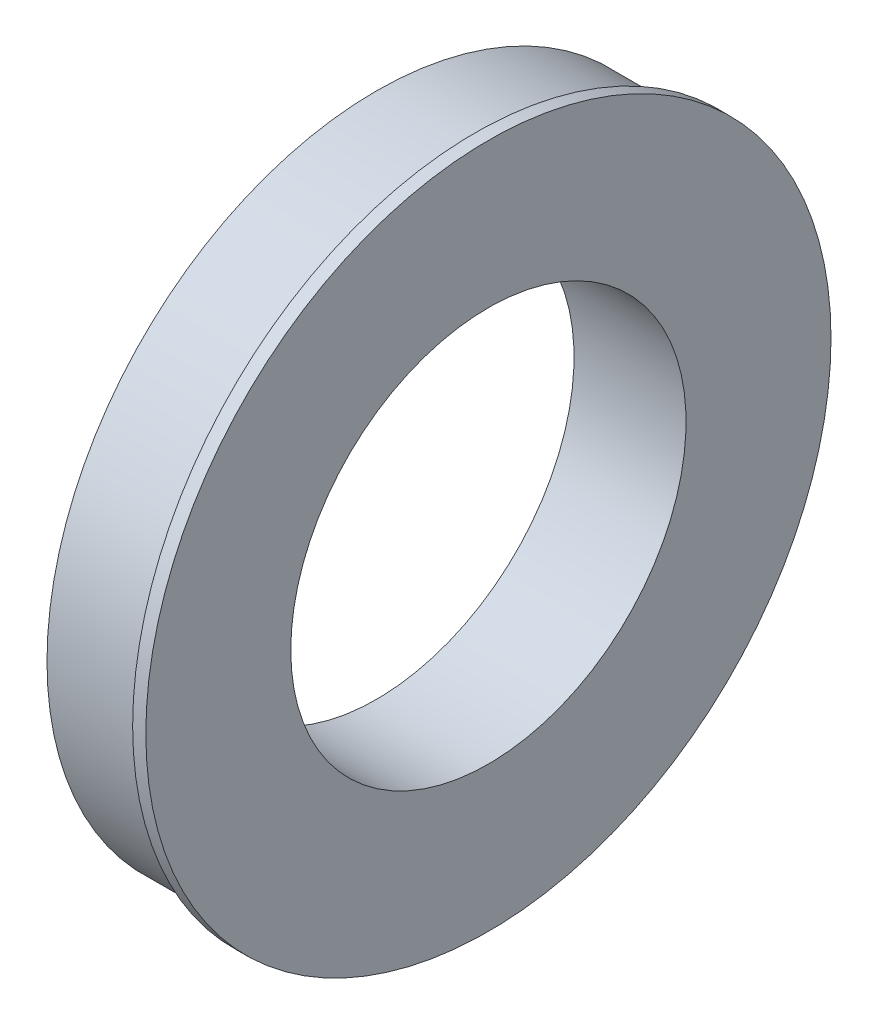
from build123d import *

# Parameters (mm, degrees)
SKETCH1_R           = 63.5
SKETCH1_R_2         = 38.1
BOSS_EXTRUDE1_DEPTH = 19.05
SKETCH2_R           = 66.04
SKETCH2_R_2         = 38.1
BOSS_EXTRUDE2_DEPTH = 2.54
SCALE1_SCALE        = 0.111317254


with BuildPart() as part:
    # Sketch1 → Boss-Extrude1 (new body)
    with BuildSketch(Plane(origin=(0, 0, 0), x_dir=(0, 0, -1), z_dir=(1, 0, 0))):
        Circle(SKETCH1_R)
        Circle(SKETCH1_R_2, mode=Mode.SUBTRACT)
    extrude(amount=BOSS_EXTRUDE1_DEPTH)

    # Sketch2 → Boss-Extrude2 (add)
    with BuildSketch(Plane(origin=(19.05, 0, 0), x_dir=(0, 0, -1), z_dir=(1, 0, 0))):
        Circle(SKETCH2_R)
        Circle(SKETCH2_R_2, mode=Mode.SUBTRACT)
    extrude(amount=BOSS_EXTRUDE2_DEPTH)


with BuildPart() as part_1:
    # Scale1: scaled about (10.935763547, 0, 0)
    add(part.part.scale(SCALE1_SCALE).moved(Location((9.718424377, 0, 0))))


solid = part_1.part
